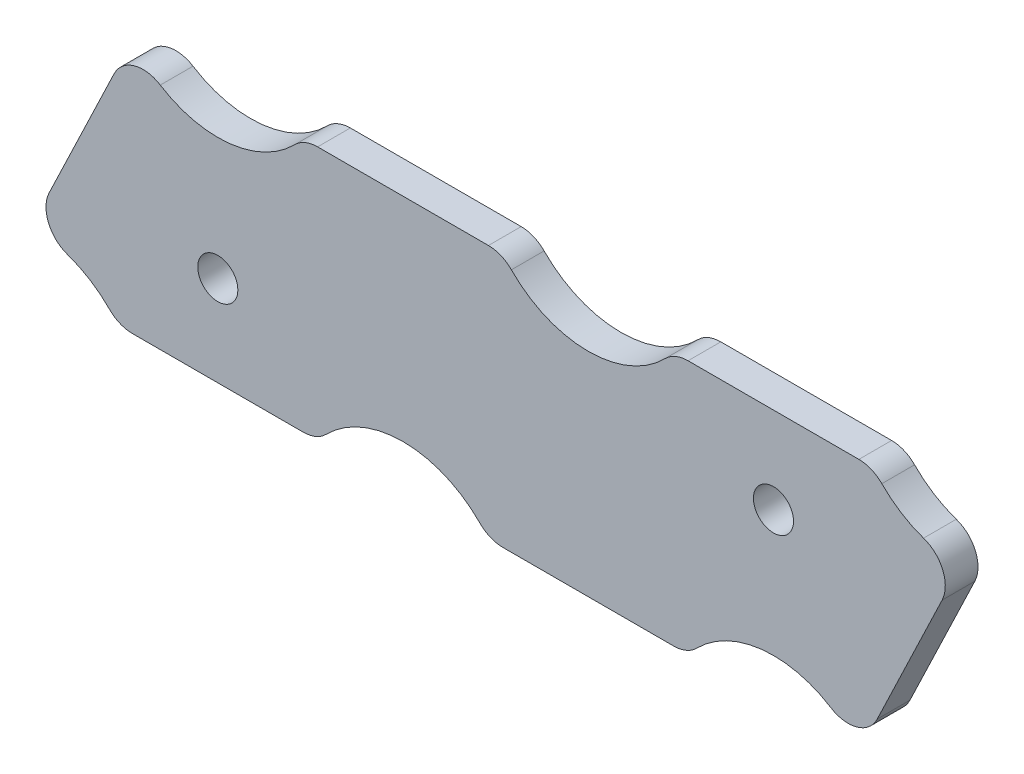
from build123d import *

# Parameters (mm, degrees)
BOSS_EXTRUDE1_DEPTH = 2.032
FILLET1_R           = 2
SKETCH4_R           = 1.2446
CUT_EXTRUDE1_DEPTH  = 75.115872934


with BuildPart() as part:
    # Sketch3 → Boss-Extrude1 (new body)
    with BuildSketch(Plane.XY):
        with BuildLine():
            ThreePointArc((10.658308864, 17.473983742), (13.670205209, 16.817167392), (16.069205037, 14.88126266))
            Line((16.069205037, 14.88126266), (28.480794963, 14.88126266))
            ThreePointArc((28.480794963, 14.88126266), (33.775, 17.475), (39.069205037, 14.88126266))
            Line((39.069205037, 14.88126266), (51.480794963, 14.88126266))
            ThreePointArc((51.480794963, 14.88126266), (56.775, 17.475), (62.069205037, 14.88126266))
            Line((62.069205037, 14.88126266), (68.391691136, 28.076016258))
            ThreePointArc((68.391691136, 28.076016258), (65.379794791, 28.732832608), (62.980794963, 30.66873734))
            Line((62.980794963, 30.66873734), (50.569205037, 30.66873734))
            ThreePointArc((50.569205037, 30.66873734), (45.275, 28.075), (39.980794963, 30.66873734))
            Line((39.980794963, 30.66873734), (27.569205037, 30.66873734))
            ThreePointArc((27.569205037, 30.66873734), (22.275, 28.075), (16.980794963, 30.66873734))
            Line((16.980794963, 30.66873734), (10.658308864, 17.473983742))
        make_face()
    extrude(amount=BOSS_EXTRUDE1_DEPTH)

    # Fillet1
    fillet1_edges = [part.edges().sort_by_distance(p)[0] for p in [
        (62.980794963, 30.66873734, 1.016),
        (50.569205037, 30.66873734, 1.016),
        (39.980794963, 30.66873734, 1.016),
        (27.569205037, 30.66873734, 1.016),
        (16.069205037, 14.88126266, 1.016),
        (28.480794963, 14.88126266, 1.016),
        (39.069205037, 14.88126266, 1.016),
        (51.480794963, 14.88126266, 1.016),
        (68.391691136, 28.076016258, 1.016),
        (62.069205037, 14.88126266, 1.016),
        (10.658308864, 17.473983742, 1.016),
        (16.980794963, 30.66873734, 1.016),
    ]]
    fillet(fillet1_edges, radius=FILLET1_R)

    # Sketch4 → Cut-Extrude1 (cut, through all)
    with BuildSketch(Plane.XY.offset(2.032)):
        with Locations((22.275, 20.49206771)):
            Circle(SKETCH4_R)
        with Locations((56.775, 25.307013878)):
            Circle(SKETCH4_R)
    extrude(amount=-CUT_EXTRUDE1_DEPTH, mode=Mode.SUBTRACT)


solid = part.part
